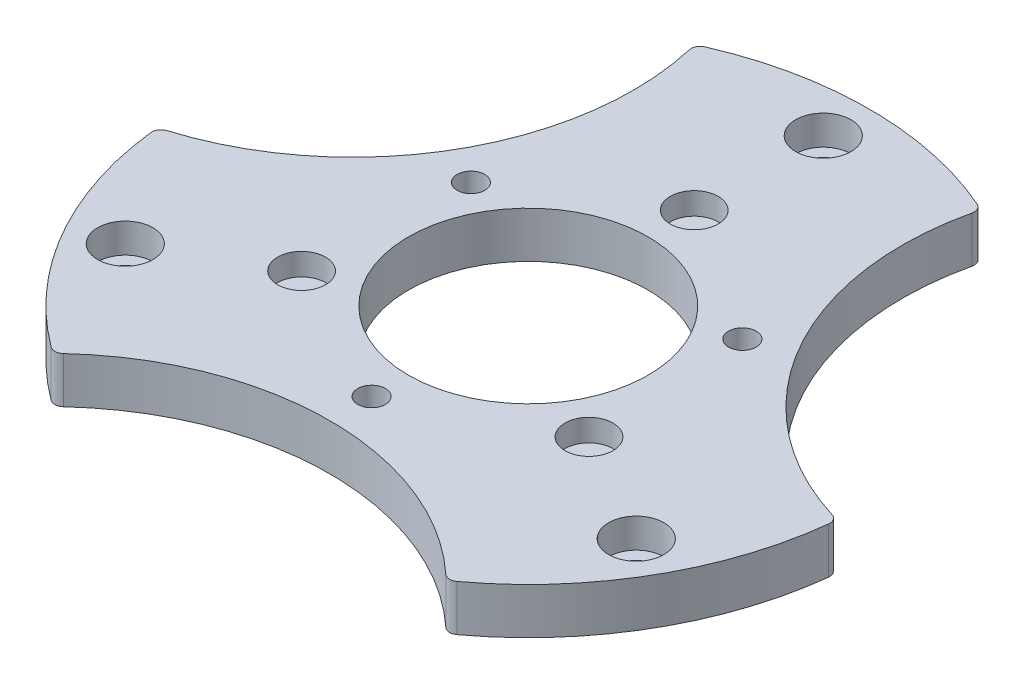
from build123d import *

# Parameters (mm, degrees)
SKETCH1_R           = 37
SKETCH1_R_2         = 13
BOSS_EXTRUDE1_DEPTH = 5
SKETCH2_R           = 1.65
CUT_EXTRUDE1_DEPTH  = 53.564246404
CIRPATTERN1_COUNT   = 3
SKETCH3_R           = 30.47
CUT_EXTRUDE2_DEPTH  = 10
CIRPATTERN2_COUNT   = 3
FILLET1_R           = 1
SKETCH4_R           = 0.75
CUT_EXTRUDE3_DEPTH  = 10
SKETCH6_R           = 2.6
CUT_EXTRUDE4_DEPTH  = 2.4
SKETCH7_R           = 3
CUT_EXTRUDE5_DEPTH  = 3.2
CIRPATTERN3_COUNT   = 3
SKETCH8_R           = 1.5
CUT_EXTRUDE6_DEPTH  = 10
CIRPATTERN4_COUNT   = 3


with BuildPart() as part:
    # Sketch1 → Boss-Extrude1 (new body)
    with BuildSketch(Plane(origin=(0, 0, 0), x_dir=(1, 0, 0), z_dir=(0, 1, 0))):
        Circle(SKETCH1_R)
        Circle(SKETCH1_R_2, mode=Mode.SUBTRACT)
    extrude(amount=BOSS_EXTRUDE1_DEPTH)

    # Sketch2 → Cut-Extrude1 (cut, through all)
    with BuildSketch(Plane(origin=(0, 5, 0), x_dir=(1, 0, 0), z_dir=(0, 1, 0))):
        with Locations((0, 32)):
            Circle(SKETCH2_R)
    cut_extrude1 = extrude(amount=-CUT_EXTRUDE1_DEPTH, mode=Mode.SUBTRACT)

    # CirPattern1: Cut-Extrude1 ×3 about axis
    cirpattern1_axis = Axis((0, 5, 0), (0, -1, 0))
    for i in range(1, CIRPATTERN1_COUNT):
        add(cut_extrude1.rotate(cirpattern1_axis, i * 360 / CIRPATTERN1_COUNT), mode=Mode.SUBTRACT)

    # Sketch3 → Cut-Extrude2 (cut)
    with BuildSketch(Plane(origin=(0, 5, 0), x_dir=(1, 0, 0), z_dir=(0, 1, 0))):
        with Locations((45.033320997, 26)):
            Circle(SKETCH3_R)
    cut_extrude2 = extrude(amount=-CUT_EXTRUDE2_DEPTH, mode=Mode.SUBTRACT)

    # CirPattern2: Cut-Extrude2 ×3 about axis
    cirpattern2_axis = Axis((0, 5, 0), (0, -1, 0))
    for i in range(1, CIRPATTERN2_COUNT):
        add(cut_extrude2.rotate(cirpattern2_axis, i * 360 / CIRPATTERN2_COUNT), mode=Mode.SUBTRACT)

    # Fillet1
    fillet1_edges = [part.edges().sort_by_distance(p)[0] for p in [
        (21.325193893, 2.5, 30.2363375),
        (-21.325193893, 2.5, 30.2363375),
        (-36.848033339, 2.5, 3.349990902),
        (-15.522839446, 2.5, -33.586328402),
        (36.848033339, 2.5, 3.349990902),
        (15.522839446, 2.5, -33.586328402),
    ]]
    fillet(fillet1_edges, radius=FILLET1_R)

    # Sketch4 → Cut-Extrude3 (cut)
    with BuildSketch(Plane(origin=(0, 5, 0), x_dir=(1, 0, 0), z_dir=(0, 1, 0))):
        with Locations((0, 18)):
            Circle(SKETCH4_R)
    cut_extrude3 = extrude(amount=-CUT_EXTRUDE3_DEPTH, mode=Mode.SUBTRACT)

    # Sketch6 → Cut-Extrude4 (cut)
    with BuildSketch(Plane(origin=(0, 5, 0), x_dir=(1, 0, 0), z_dir=(0, 1, 0))):
        with Locations((0, 18)):
            Circle(SKETCH6_R)
    cut_extrude4 = extrude(amount=-CUT_EXTRUDE4_DEPTH, mode=Mode.SUBTRACT)

    # Sketch7 → Cut-Extrude5 (cut)
    with BuildSketch(Plane(origin=(0, 5, 0), x_dir=(1, 0, 0), z_dir=(0, 1, 0))):
        with Locations((0, 32)):
            Circle(SKETCH7_R)
    cut_extrude5 = extrude(amount=-CUT_EXTRUDE5_DEPTH, mode=Mode.SUBTRACT)

    # CirPattern3: Cut-Extrude3, Cut-Extrude4, Cut-Extrude5 ×3 about axis
    cirpattern3_axis = Axis((0, 5, 0), (0, -1, 0))
    add([cut_extrude3.rotate(cirpattern3_axis, i * 360 / CIRPATTERN3_COUNT) for i in range(1, CIRPATTERN3_COUNT)], mode=Mode.SUBTRACT)
    add([cut_extrude4.rotate(cirpattern3_axis, i * 360 / CIRPATTERN3_COUNT) for i in range(1, CIRPATTERN3_COUNT)], mode=Mode.SUBTRACT)
    add([cut_extrude5.rotate(cirpattern3_axis, i * 360 / CIRPATTERN3_COUNT) for i in range(1, CIRPATTERN3_COUNT)], mode=Mode.SUBTRACT)

    # Sketch8 → Cut-Extrude6 (cut)
    with BuildSketch(Plane(origin=(0, 5, 0), x_dir=(1, 0, 0), z_dir=(0, 1, 0))):
        with Locations((14.722431864, 8.5)):
            Circle(SKETCH8_R)
    cut_extrude6 = extrude(amount=-CUT_EXTRUDE6_DEPTH, mode=Mode.SUBTRACT)

    # CirPattern4: Cut-Extrude6 ×3 about axis
    cirpattern4_axis = Axis((0, 5, 0), (0, -1, 0))
    for i in range(1, CIRPATTERN4_COUNT):
        add(cut_extrude6.rotate(cirpattern4_axis, i * 360 / CIRPATTERN4_COUNT), mode=Mode.SUBTRACT)


solid = part.part
